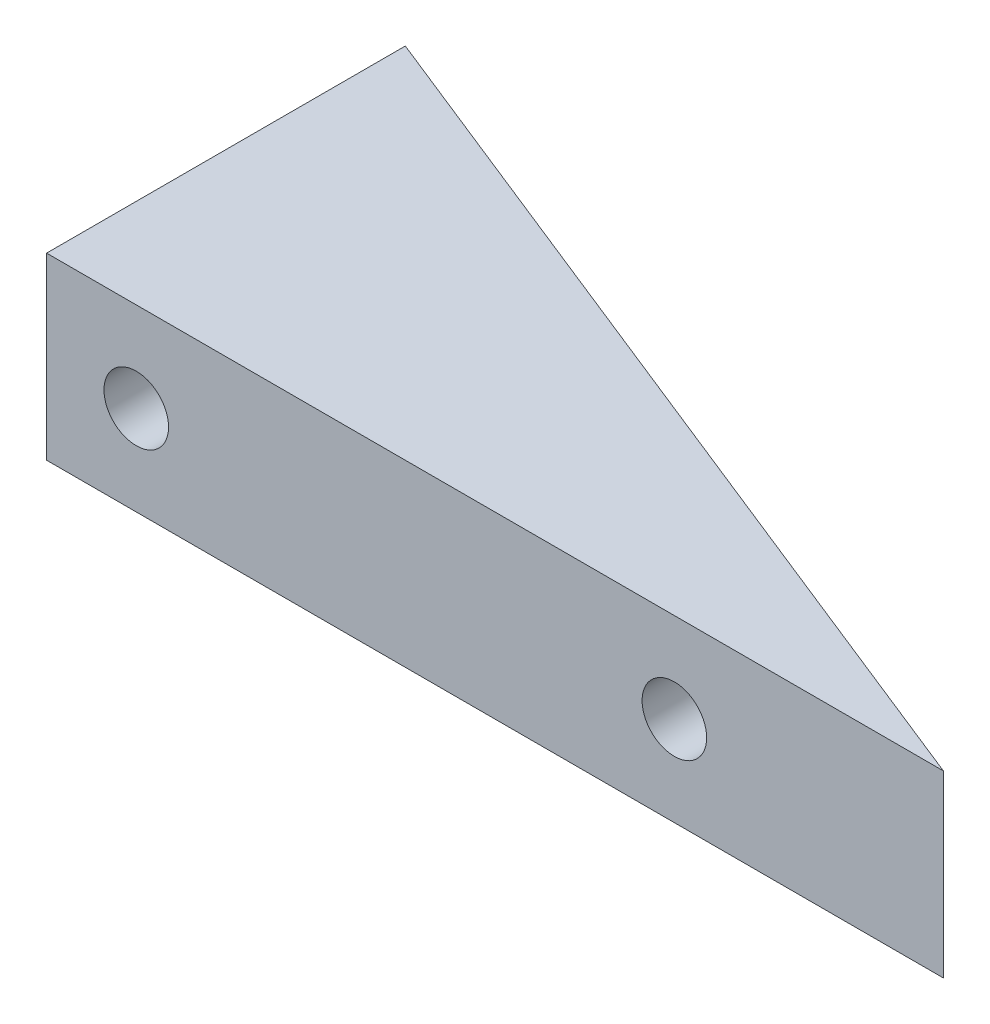
from build123d import *

# Parameters (mm, degrees)
BOSS_EXTRUDE1_DEPTH = 12.7
SKETCH2_R           = 2.286
CUT_EXTRUDE1_DEPTH  = 70.560764803


with BuildPart() as part:
    # Sketch1 → Boss-Extrude1 (new body)
    with BuildSketch(Plane(origin=(0, 0, 0), x_dir=(1, 0, 0), z_dir=(0, 1, 0))):
        Polygon((0, 0), (0, 25.4), (63.5, 0), align=None)
    extrude(amount=BOSS_EXTRUDE1_DEPTH)

    # Sketch2 → Cut-Extrude1 (cut, through all)
    with BuildSketch(Plane.XY.offset(-25.4)):
        with Locations((44.45, 6.35)):
            Circle(SKETCH2_R)
        with Locations((6.35, 6.35)):
            Circle(SKETCH2_R)
    extrude(amount=CUT_EXTRUDE1_DEPTH, mode=Mode.SUBTRACT)


solid = part.part
